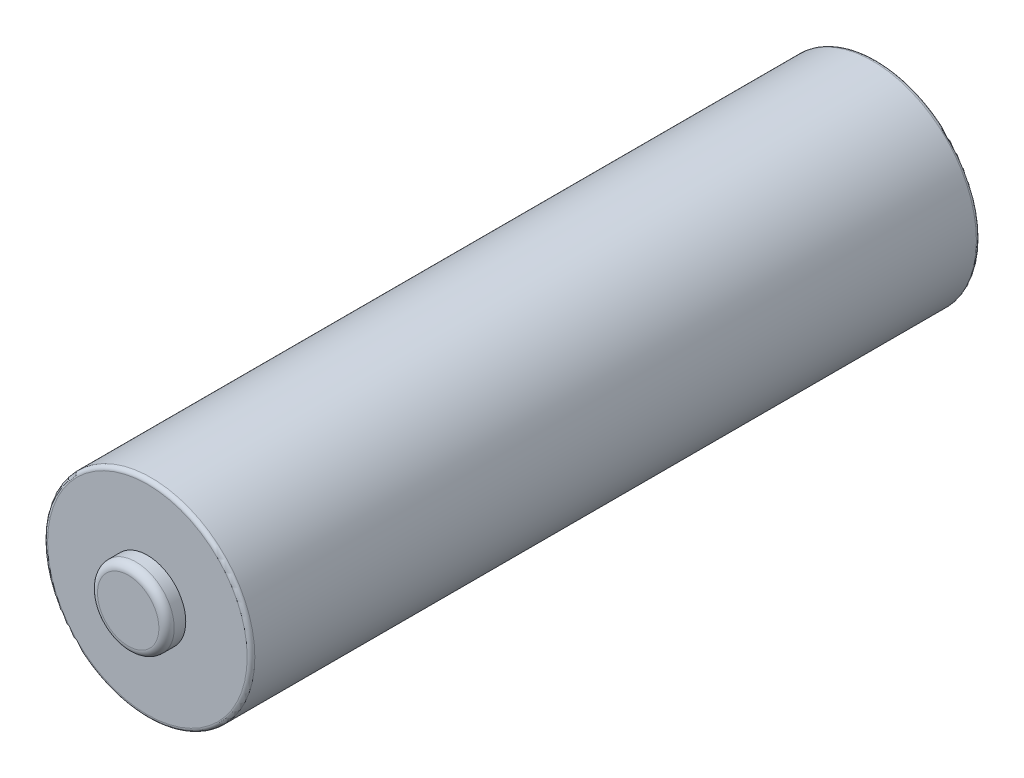
from build123d import *
from OCP.BRepAlgoAPI import BRepAlgoAPI_Cut
from OCP.TopTools import TopTools_ListOfShape

# Parameters (mm, degrees)
SKETCH1_R           = 6.858
BOSS_EXTRUDE1_DEPTH = 48.26
FILLET1_R           = 0.254
SKETCH2_R           = 2.54
BOSS_EXTRUDE2_DEPTH = 1.27
FILLET2_R           = 0.508


with BuildPart() as part:
    # Sketch1 → Boss-Extrude1 (new body)
    with BuildSketch(Plane.XY):
        with Locations(Location((0, 0, 0), (0, 0, 180))):
            Circle(SKETCH1_R)
    extrude(amount=BOSS_EXTRUDE1_DEPTH)

    # Fillet1
    fillet1_edges = [part.edges().sort_by_distance(p)[0] for p in [
        (6.858, 0, 0),
        (6.858, 0, 48.26),
    ]]
    fillet(fillet1_edges, radius=FILLET1_R)

    # Sketch2 → Boss-Extrude2 (add)
    with BuildSketch(Plane.XY.offset(48.26)):
        Circle(SKETCH2_R)
    extrude(amount=BOSS_EXTRUDE2_DEPTH)

    # Fillet2
    fillet2_edges = [part.edges().sort_by_distance(p)[0] for p in [
        (-2.54, 0, 49.53),
    ]]
    fillet(fillet2_edges, radius=FILLET2_R)


with BuildPart() as dome1_tool:
    # Dome1: read off the stored shape, not the designer's step
    # Dome1 outline → Dome1 (revolve)
    with BuildSketch(Plane.XZ):
        with BuildLine():
            Line((0, 0), (6.604000859, -7e-09))
            ThreePointArc((6.604000859, -7e-09), (3.302024852, 0.019049975), (0, 0.0254))
            Line((0, 0.0254), (0, 0))
        make_face()
    revolve(axis=Axis((0, 0, 0), (0, 0, 1)))


with BuildPart() as part_1:
    add(part.part)

    # Dome1: cut by dome1_tool, with a tolerance
    dome1_stock = TopTools_ListOfShape()
    dome1_stock.Append(part_1.part.wrapped)
    dome1_tools = TopTools_ListOfShape()
    dome1_tools.Append(dome1_tool.part.wrapped)
    dome1_cut = BRepAlgoAPI_Cut()
    dome1_cut.SetArguments(dome1_stock)
    dome1_cut.SetTools(dome1_tools)
    dome1_cut.SetFuzzyValue(0.00001)
    dome1_cut.Build()
    add(Compound.cast(dome1_cut.Shape()).solids(), mode=Mode.REPLACE)


solid = part_1.part
